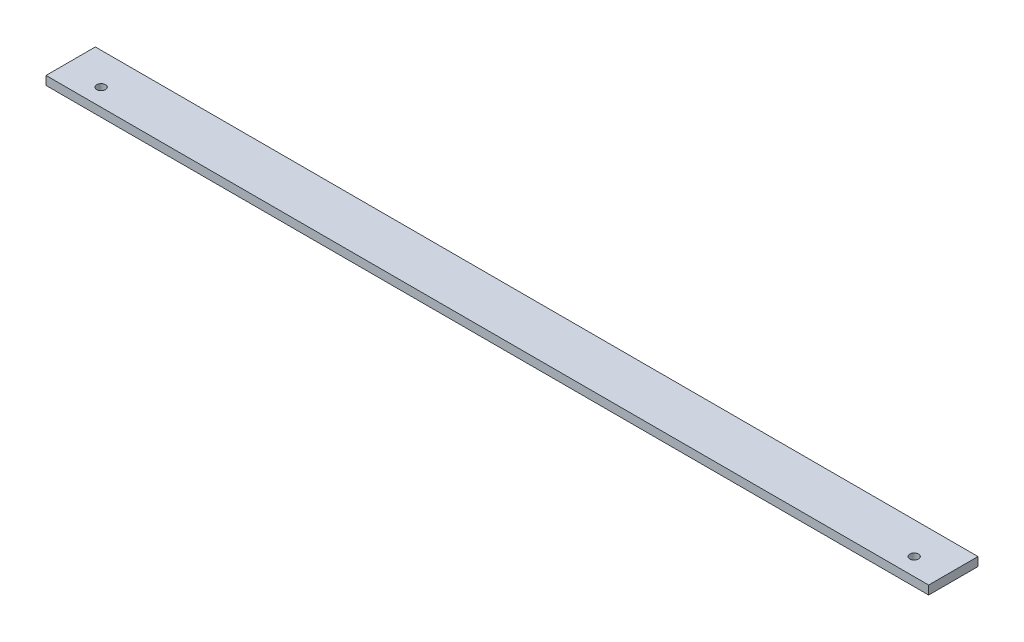
from build123d import *

# Parameters (mm, degrees)
SKETCH1_W           = 304
SKETCH1_H           = 17
SKETCH1_R           = 1.5
BOSS_EXTRUDE1_DEPTH = 3


with BuildPart() as part:
    # Sketch1 → Boss-Extrude1 (new body)
    with BuildSketch(Plane(origin=(0, 3, 0), x_dir=(1, 0, 0), z_dir=(0, 1, 0))):
        with Locations((0, 2.5)):
            Rectangle(SKETCH1_W, SKETCH1_H)
        with Locations((141, 0)):
            Circle(SKETCH1_R, mode=Mode.SUBTRACT)
        with Locations((-139, 0)):
            Circle(SKETCH1_R, mode=Mode.SUBTRACT)
    extrude(amount=-BOSS_EXTRUDE1_DEPTH)


solid = part.part
